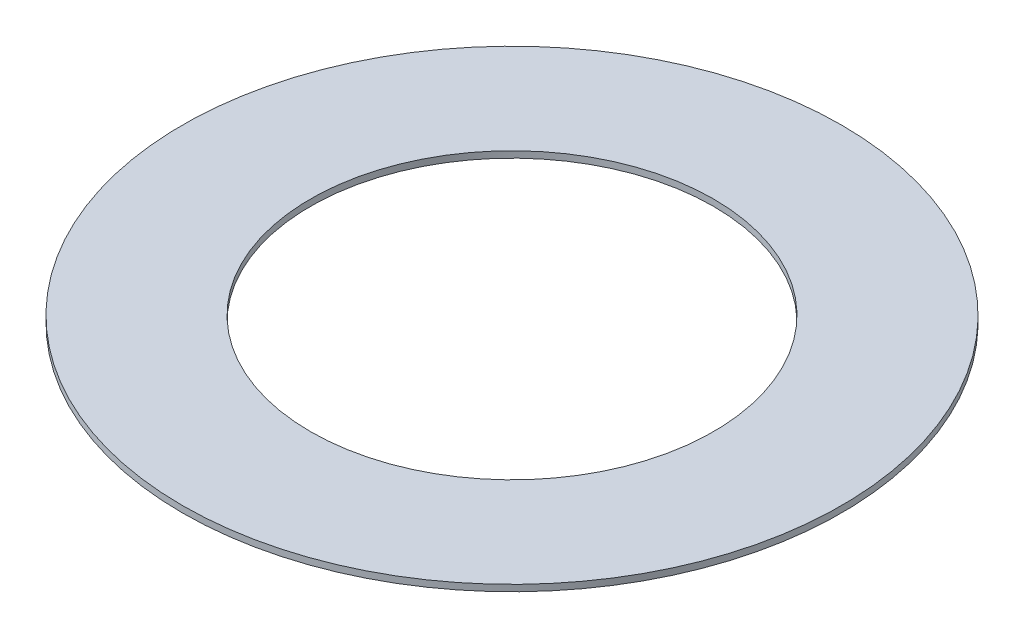
from build123d import *

# Parameters (mm, degrees)
SKETCH1_R           = 130
SKETCH1_R_2         = 79.5
BOSS_EXTRUDE1_DEPTH = 2.54


with BuildPart() as part:
    # Sketch1 → Boss-Extrude1 (new body)
    with BuildSketch(Plane(origin=(0, 0, 0), x_dir=(1, 0, 0), z_dir=(0, 1, 0))):
        Circle(SKETCH1_R)
        Circle(SKETCH1_R_2, mode=Mode.SUBTRACT)
    extrude(amount=BOSS_EXTRUDE1_DEPTH)


solid = part.part
